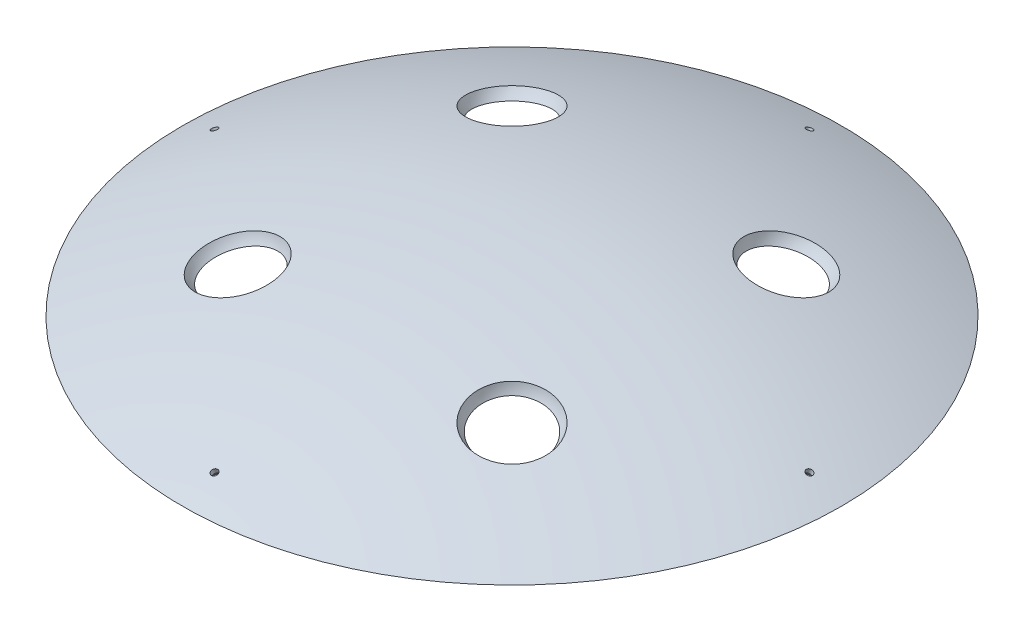
from build123d import *

# Parameters (mm, degrees)
CIRPATTERN2_COUNT = 4
CIRPATTERN3_COUNT = 4
SCALE1_SCALE      = 0.8


with BuildPart() as part:
    # Sketch1 → Revolve1 (revolve)
    with BuildSketch(Plane.XY):
        with BuildLine():
            ThreePointArc((-96.45037224464366, 351.28399877517677), (-98.30491056438511, 350.49968615568724), (-100.15307171298416, 349.70046213622277))
            Line((-100.15307171298414, 349.70046213622277), (-96.45037224464365, 348.0287940258773))
            ThreePointArc((-96.45037224464366, 348.0287940258773), (-49.21182939578574, 362.6864648085931), (-8.2076e-13, 367.6385442483865))
            Line((-8.2076e-13, 367.6385442483865), (0, 370.6385442483864))
            ThreePointArc((0, 370.63854424838644), (-49.186565077785374, 365.75215426596327), (-96.45037224464366, 351.28399877517677))
        make_face()
    revolve(axis=Axis((0, 394.9444665319611, 0), (-3.49e-15, 1, 0)))

    # Sketch3 → Cut-Revolve1 (revolve, cut)
    with BuildSketch(Plane.XY):
        with BuildLine():
            ThreePointArc((-89.44663915168537, 354.08939291779734), (-89.91336288865955, 353.91003237767376), (-90.37972697038383, 353.7297387469322))
            Line((-90.37972697038381, 353.72973874693224), (-89.29517024674095, 350.932644412949))
            ThreePointArc((-89.29517024674095, 350.932644412949), (-88.36206599267746, 351.29227886698254), (-87.42751336416944, 351.64813259258915))
            Line((-87.42751336416187, 351.64813259259216), (-87.97199164739912, 353.0523534026404))
            ThreePointArc((-87.97199164739861, 353.0523534026405), (-88.43871864642989, 352.8730013089223), (-88.90508383056502, 352.6927104878234))
            Line((-88.90508383056729, 352.6927104878225), (-89.44663915168167, 354.0893929177988))
        make_face()
    cut_revolve1 = revolve(axis=Axis((4.163e-14, 120.6385442483865, 0), (-0.3615189078815354, 0.9323647779941829, 0)), mode=Mode.SUBTRACT)

    # CirPattern2: Cut-Revolve1 ×4 about axis
    cirpattern2_axis = Axis((0, 0, 0), (0, 1, 0))
    for i in range(1, CIRPATTERN2_COUNT):
        add(cut_revolve1.rotate(cirpattern2_axis, i * 360 / CIRPATTERN2_COUNT), mode=Mode.SUBTRACT)

    # Sketch5 → Cut-Revolve5 (revolve, cut)
    with BuildSketch(Plane(origin=(0, 0, 0), x_dir=(0, 1, 0), z_dir=(0.7071067811865488, 0, 0.7071067811865464))):
        with BuildLine():
            Line((380.2885442483865, 60), (354.9885442483865, 60))
            ThreePointArc((354.9885442483865, 60), (358.1637224670814, 51.618457647156696), (366.0953034914705, 47.44448694930419))
            ThreePointArc((366.0953034914705, 47.44448694930419), (376.0200866012298, 50.525178218694904), (380.2885442483865, 60))
        make_face()
    cut_revolve5 = revolve(axis=Axis((-42.426406871192775, 354.9885442483865, 42.426406871192924), (0, -1, 0)), mode=Mode.SUBTRACT)

    # CirPattern3: Cut-Revolve5 ×4 about axis
    cirpattern3_axis = Axis((0, 0, 0), (0, 1, 0))
    for i in range(1, CIRPATTERN3_COUNT):
        add(cut_revolve5.rotate(cirpattern3_axis, i * 360 / CIRPATTERN3_COUNT), mode=Mode.SUBTRACT)


with BuildPart() as part_1:
    # Scale1: scaled about (0, 0, 0)
    add(part.part.scale(SCALE1_SCALE))


solid = part_1.part
